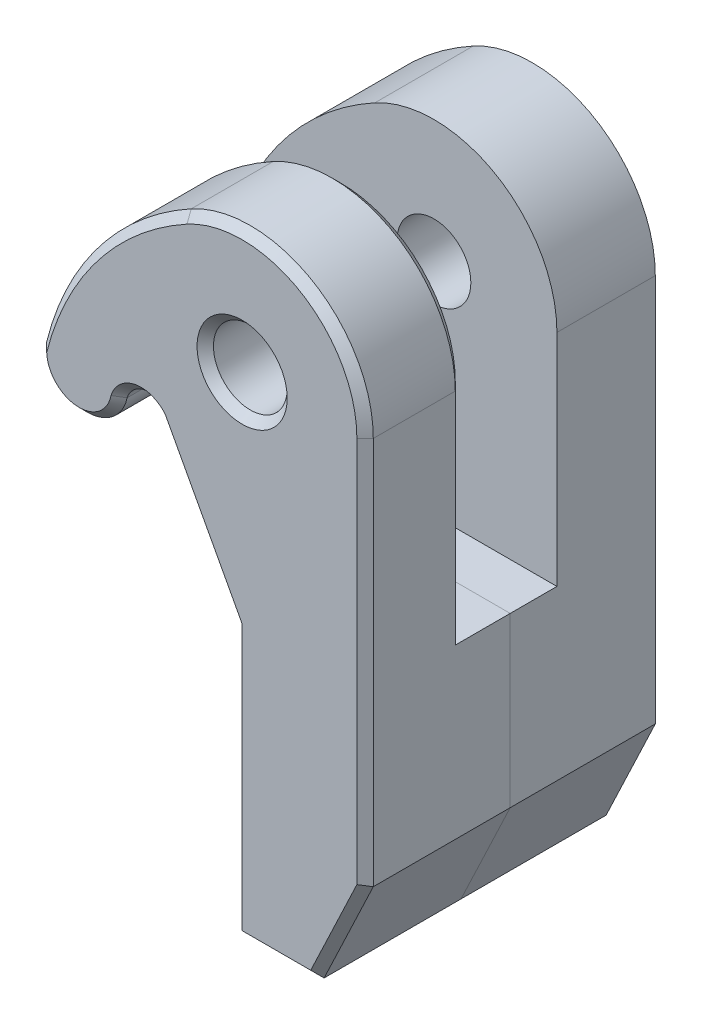
from build123d import *

# Parameters (mm, degrees)
SKETCH1_R           = 2.25
BOSS_EXTRUDE1_DEPTH = 6
BOSS_EXTRUDE2_DEPTH = 2.85
CHAMFER1_SIZE       = 0.5
CHAMFER4_SIZE       = 0.5


with BuildPart() as part:
    # Sketch1 → Boss-Extrude1 (new body)
    with BuildSketch(Plane.XY):
        with BuildLine():
            Line((7.5, 0), (7.5, -23.678709565))
            Line((7.5, -23.678709565), (4.5, -30))
            Line((4.5, -30), (-0.5, -30))
            Line((-0.5, -30), (-0.5, -13.416407865))
            Line((-0.5, -13.416407865), (-5.105036517, -4.854116258))
            ThreePointArc((-5.105036517, -4.854116258), (-6.45581184, -4.407563939), (-7.51324337, -5.359321001))
            ThreePointArc((-7.51324337, -5.359321001), (-10.19445484, -7.320369402), (-12.419809017, -4.854116258))
            ThreePointArc((-12.419809017, -4.854116258), (-9.208102345, 1.784082351), (-3.604023267, 6.577310719))
            ThreePointArc((-3.604023267, 6.577310719), (3.822291557, 6.452913082), (7.5, 0))
        make_face()
        Circle(SKETCH1_R, mode=Mode.SUBTRACT)
    extrude(amount=BOSS_EXTRUDE1_DEPTH)

    # Sketch2 → Boss-Extrude2 (add)
    with BuildSketch(Plane(origin=(0, 0, 0), x_dir=(-1, 0, 0), z_dir=(0, 0, -1))):
        Polygon((0.5, -30), (0.5, -13.416407865), (-7.5, -13.416407865), (-7.5, -23.678709565), (-4.5, -30), align=None)
    extrude(amount=BOSS_EXTRUDE2_DEPTH)


with BuildPart() as body_2:
    # Mirror2: mirrored copy
    add(part.part.mirror(Plane(origin=(0, 0, -2.85), x_dir=(1, 0, 0), z_dir=(0, 0, -1))))


with BuildPart() as part_1:
    add(part.part)

    # Chamfer1
    chamfer1_edges = [part_1.edges().sort_by_distance(p)[0] for p in [
        (7.5, -11.839354782, 6),
        (-9.208102345, 1.784082351, 6),
        (3.822291557, 6.452913082, 6),
    ]]
    chamfer(chamfer1_edges, length=CHAMFER1_SIZE)
    chamfer1_2_edges = [part_1.edges().sort_by_distance(p)[0] for p in [
        (-2.25, 0, 6),
    ]]
    chamfer(chamfer1_2_edges, length=CHAMFER1_SIZE)
    chamfer1_3_edges = [part_1.edges().sort_by_distance(p)[0] for p in [
        (-0.5, -21.708203932, 6),
    ]]
    chamfer(chamfer1_3_edges, length=CHAMFER1_SIZE)
    chamfer1_4_edges = [part_1.edges().sort_by_distance(p)[0] for p in [
        (2.25, -30, 6),
    ]]
    chamfer(chamfer1_4_edges, length=CHAMFER1_SIZE)
    chamfer1_5_edges = [part_1.edges().sort_by_distance(p)[0] for p in [
        (-6.45581184, -4.407563939, 6),
    ]]
    chamfer(chamfer1_5_edges, length=CHAMFER1_SIZE)
    chamfer1_6_edges = [part_1.edges().sort_by_distance(p)[0] for p in [
        (-9.615213291, -7.311974374, 6),
    ]]
    chamfer(chamfer1_6_edges, length=CHAMFER1_SIZE)
    chamfer1_7_edges = [part_1.edges().sort_by_distance(p)[0] for p in [
        (5.86864666, -27.116128985, 6),
    ]]
    chamfer(chamfer1_7_edges, length=CHAMFER1_SIZE)
    chamfer1_8_edges = [part_1.edges().sort_by_distance(p)[0] for p in [
        (-2.802518259, -9.135262062, 6),
    ]]
    chamfer(chamfer1_8_edges, length=CHAMFER1_SIZE)

    # Chamfer4
    chamfer4_edges = [part_1.edges().sort_by_distance(p)[0] for p in [
        (-2.25, 0, 0),
    ]]
    chamfer(chamfer4_edges, length=CHAMFER4_SIZE)
    chamfer4_2_edges = [part_1.edges().sort_by_distance(p)[0] for p in [
        (3.822291557, 6.452913082, 0),
        (-9.208102345, 1.784082351, 0),
        (7.5, -6.708203932, 0),
    ]]
    chamfer(chamfer4_2_edges, length=CHAMFER4_SIZE)
    chamfer4_3_edges = [part_1.edges().sort_by_distance(p)[0] for p in [
        (-6.45581184, -4.407563939, 0),
    ]]
    chamfer(chamfer4_3_edges, length=CHAMFER4_SIZE)
    chamfer4_4_edges = [part_1.edges().sort_by_distance(p)[0] for p in [
        (-2.802518259, -9.135262062, 0),
    ]]
    chamfer(chamfer4_4_edges, length=CHAMFER4_SIZE)
    chamfer4_5_edges = [part_1.edges().sort_by_distance(p)[0] for p in [
        (-9.615213291, -7.311974374, 0),
    ]]
    chamfer(chamfer4_5_edges, length=CHAMFER4_SIZE)


solid = Compound([body_2.part, part_1.part])
